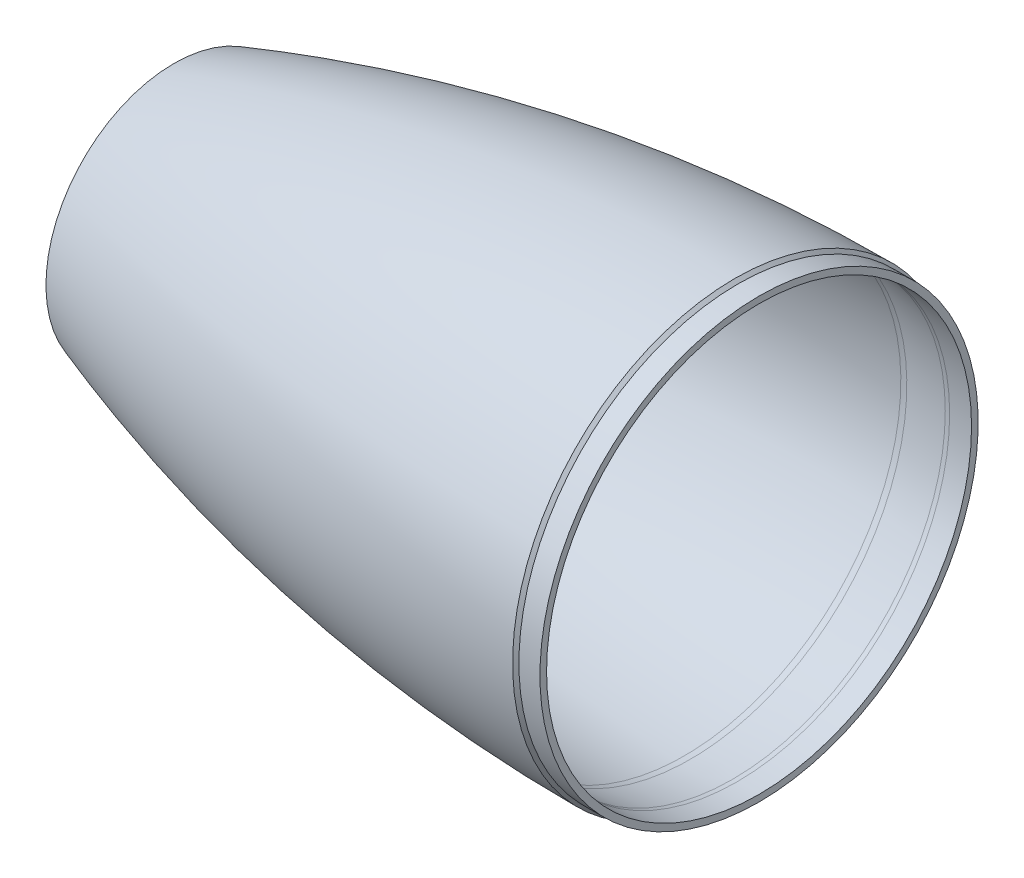
from build123d import *


with BuildPart() as part:
    # Sketch1 → Revolve1 (revolve)
    with BuildSketch(Plane.XY):
        with BuildLine():
            Line((-203.2, 46.355), (-203.2, 41.4655))
            Line((-203.2, 41.4655), (-193.130256121, 41.4655))
            ThreePointArc((-193.130256121, 41.4655), (-190.700216326, 41.948864969), (-188.640128061, 43.325371939))
            Line((-188.640128061, 43.325371939), (-181.084207326, 50.881292674))
            ThreePointArc((-181.084207326, 50.881292674), (-179.852036519, 51.841688858), (-178.422670867, 52.47218038))
            ThreePointArc((-178.422670867, 52.47218038), (-99.223590836, 70.721416723), (-18.317216248, 78.447182433))
            ThreePointArc((-18.317216248, 78.447182433), (-17.204530335, 78.447581961), (-16.093719104, 78.383017976))
            Line((-16.093719104, 78.383017976), (-0.828575937, 77.047491001))
            ThreePointArc((-0.828575937, 77.047491001), (0.000791633, 76.993131379), (0.831740962, 76.975))
            Line((0.831740962, 76.975), (8.763, 76.975))
            Line((8.763, 76.975), (8.763, 79.375))
            Line((8.763, 79.375), (1.143, 79.375))
            Line((1.143, 79.375), (0, 80.518))
            ThreePointArc((0, 80.518), (-103.025907626, 71.917734953), (-203.2, 46.355))
        make_face()
    revolve(axis=Axis((0, 0, 0), (-1, 0, 0)))


solid = part.part
